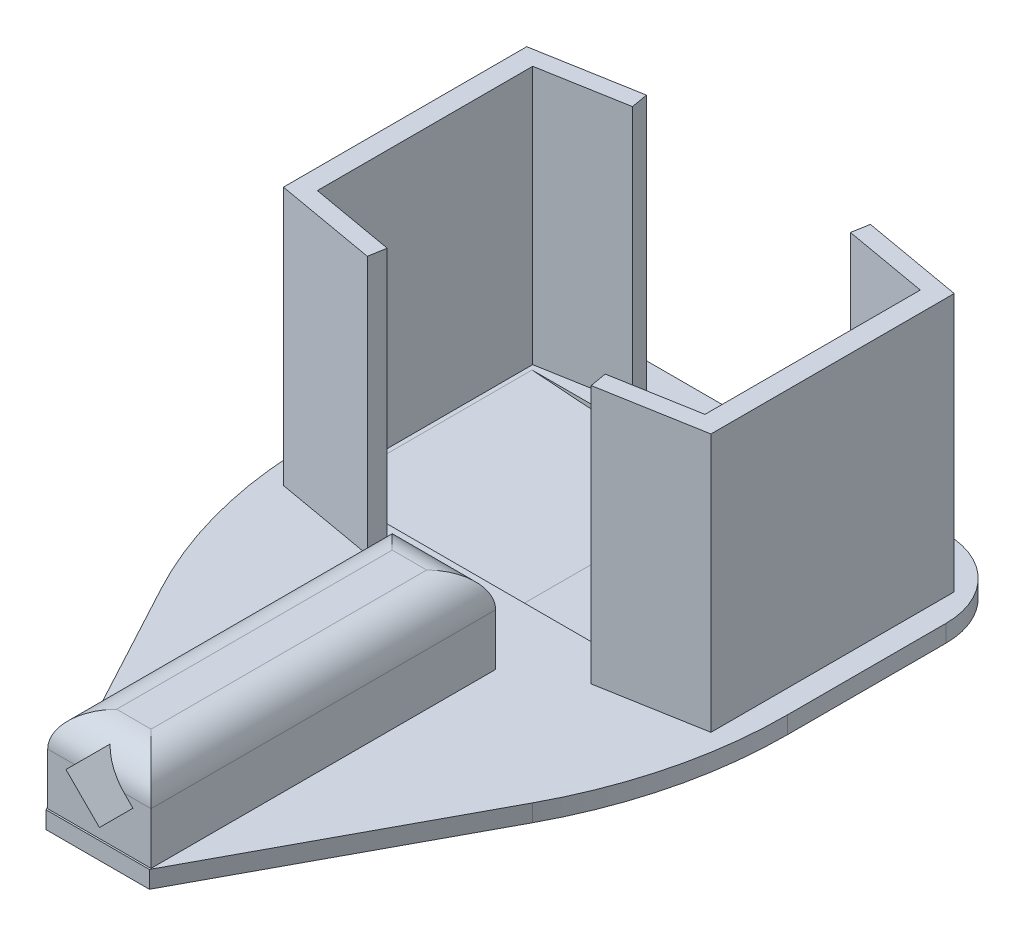
from build123d import *

# Parameters (mm, degrees)
BOSS_EXTRUDE1_DEPTH = 2
BOSS_EXTRUDE2_DEPTH = 30
SKETCH3_W           = 12
SKETCH3_H           = 40
BOSS_EXTRUDE3_DEPTH = 10
CUT_EXTRUDE1_DEPTH  = 35
SKETCH6_W           = 44
SKETCH6_H           = 23.882016553
CUT_EXTRUDE2_DEPTH  = 1
FILLET1_R           = 280
FILLET2_R           = 9
FILLET3_R           = 4
FILLET4_R           = 50


with BuildPart() as part:
    # Sketch1 → Boss-Extrude1 (new body)
    with BuildSketch(Plane(origin=(0, 0, 0), x_dir=(1, 0, 0), z_dir=(0, 1, 0))):
        Polygon((-27.5, 1.096246938), (-6, -38.903753062), (6, -38.903753062), (27.5, 1.096246938), (27.5, 41.096246938), (-27.5, 41.096246938), align=None)
    extrude(amount=BOSS_EXTRUDE1_DEPTH)

    # Sketch2 → Boss-Extrude2 (add)
    with BuildSketch(Plane(origin=(0, 2, 0), x_dir=(1, 0, 0), z_dir=(0, 1, 0))):
        Polygon((-22.5, 9.101662984), (-22.5, 34.101662984), (-12.65192247, 35.838144761), (-12.999218825, 37.807760267), (-24.816911861, 35.723982135), (-24.816911861, 7.479343833), (-12.999218825, 5.395565701), (-12.65192247, 7.365181207), align=None)
        Polygon((12.65192247, 7.365181207), (12.999218825, 5.395565701), (24.816911861, 7.479343833), (24.816911861, 35.723982135), (12.999218825, 37.807760267), (12.65192247, 35.838144761), (22.5, 34.101662984), (22.5, 9.101662984), align=None)
    extrude(amount=BOSS_EXTRUDE2_DEPTH)

    # Sketch3 → Boss-Extrude3 (add)
    with BuildSketch(Plane(origin=(0, 2, 0), x_dir=(1, 0, 0), z_dir=(0, 1, 0))):
        with Locations((-0.005517933, -18.7)):
            Rectangle(SKETCH3_W, SKETCH3_H)
    extrude(amount=BOSS_EXTRUDE3_DEPTH)

    # Sketch4 → Cut-Extrude1 (cut)
    with BuildSketch(Plane.XY.offset(38.7)):
        Polygon((0, 3.110912703), (3.889087297, 7), (0, 10.889087297), (-3.889087297, 7), align=None)
    extrude(amount=-CUT_EXTRUDE1_DEPTH, mode=Mode.SUBTRACT)

    # Sketch6 → Cut-Extrude2 (cut)
    with BuildSketch(Plane(origin=(0, 2, 0), x_dir=(1, 0, 0), z_dir=(0, 1, 0))):
        with Locations((0, 21.585626422)):
            Rectangle(SKETCH6_W, SKETCH6_H)
    extrude(amount=-CUT_EXTRUDE2_DEPTH, mode=Mode.SUBTRACT)

    # Fillet1
    # the kernel refuses this fillet: 280 mm, written as the material it adds along each edge
    with BuildSketch(Plane(origin=(22, 1, -92.634586786), x_dir=(0, 1, 0), z_dir=(0, 0, 1))) as fillet1_piece_1_section:
        with BuildLine():
            CenterArc((280, 23.643180835), FILLET1_R, 180, 4.843819526)
            Line((0, 23.643180835), (0, 0))
            Line((0, 0), (1, 0))
        make_face()
    fillet1_piece_1 = extrude(amount=142.097920729, mode=Mode.PRIVATE)
    fillet1_piece_1 = split(fillet1_piece_1, bisect_by=Plane(origin=(13.044676358, 1.194161729, -5.403581091), z_dir=(-0.17364817766692942, 0, -0.9848077530122082)), keep=Keep.TOP, mode=Mode.PRIVATE)
    fillet1_piece_1 = split(fillet1_piece_1, bisect_by=Plane(origin=(13.050161185, 1.194161729, -37.798777754), z_dir=(-0.1736481776669295, 0, 0.9848077530122082)), keep=Keep.TOP, mode=Mode.PRIVATE)
    add(fillet1_piece_1)
    with BuildSketch(Plane(origin=(-22, 1, -9.644618145), x_dir=(0, 1, 0), z_dir=(0, 0, -1))) as fillet1_piece_2:
        with BuildLine():
            CenterArc((280, 23.643180835), FILLET1_R, 180, 4.843819526)
            Line((0, 23.643180835), (0, 0))
            Line((0, 0), (1, 0))
        make_face()
    extrude(amount=23.882016554)

    # Fillet2
    fillet2_edges = [part.edges().sort_by_distance(p)[0] for p in [
        (-27.5, 1, -41.096246938),
        (27.5, 1, -41.096246938),
    ]]
    fillet(fillet2_edges, radius=FILLET2_R)

    # Fillet3
    # the kernel refuses this fillet: 4 mm, written as the material it takes off along each edge
    with BuildSketch(Plane(origin=(5.994482067, 12, 48.7), x_dir=(0, -1, 0), z_dir=(0, 0, -1)), Plane(origin=(-6.005517933, 12, -11.3), x_dir=(0, -1, 0), z_dir=(0, 0, 1))) as fillet3_piece_1:
        with BuildLine():
            CenterArc((FILLET3_R, FILLET3_R), FILLET3_R, 180, 90)
            Line((0, FILLET3_R), (0, 0))
            Line((0, 0), (FILLET3_R, 0))
        make_face()
    extrude(amount=60, mode=Mode.SUBTRACT)
    with BuildSketch(Plane(origin=(15.994482067, 12, -1.3), x_dir=(0, -1, 0), z_dir=(-1, 0, 0)), Plane(origin=(-16.005517933, 12, 38.7), x_dir=(0, -1, 0), z_dir=(1, 0, 0))) as fillet3_piece_2:
        with BuildLine():
            CenterArc((FILLET3_R, FILLET3_R), FILLET3_R, 180, 90)
            Line((0, FILLET3_R), (0, 0))
            Line((0, 0), (FILLET3_R, 0))
        make_face()
    extrude(amount=32, mode=Mode.SUBTRACT)

    # Fillet4
    fillet4_edges = [part.edges().sort_by_distance(p)[0] for p in [
        (-27.5, 1, -1.096246938),
        (27.5, 1, -1.096246938),
    ]]
    fillet(fillet4_edges, radius=FILLET4_R)


solid = part.part
